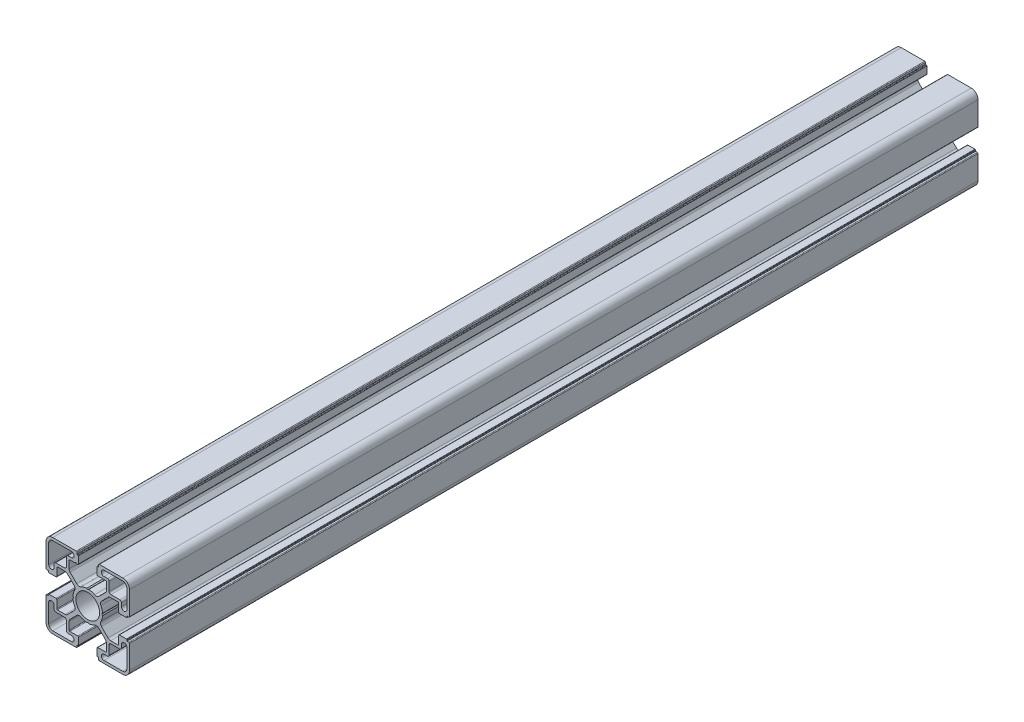
from build123d import *

# Parameters (mm, degrees)
BOSS_EXTRUDE1_DEPTH      = 228.6
FILLET4_R                = 1.885
FILLET5_R                = 0.377
DELETEFACE1_START        = -228.6
DELETEFACE1_DEPTH        = 457.2
CUT_EXTRUDE1_DEPTH       = 231.803942774
CIRPATTERN2_COUNT        = 3
CIRPATTERN2_ANGLE        = 180
FILLET2_R                = 0.377
FILLET3_R                = 0.1885
CUT_EXTRUDE2_DEPTH       = 459.305945848
CUT_EXTRUDE2_DEPTH_BACK  = 459.305945848
SKETCH5_R                = 6.375
BOSS_EXTRUDE2_DEPTH      = 203.2
FILLET6_R                = 0.377
CIRPATTERN1_COUNT        = 8
FILLET6_OF_CIRPATTERN1_R = 0.377
CUT_EXTRUDE3_DEPTH       = 231.803942774
CUT_EXTRUDE3_DEPTH_BACK  = 231.803942774


# Read off the part's stored shape, not the designer's step: DeleteFace1
with BuildPart() as part:
    # Sketch3 → Boss-Extrude1 (new, symmetric)
    with BuildSketch(Plane.XY):
        with BuildLine():
            Line((0, -8), (0, -5))
            ThreePointArc((0, -5), (3.535533906, -3.535533906), (5, 0))
            Line((5, 0), (8, 0))
            ThreePointArc((8, 0), (7.57237156, -2.58054044), (6.335202759, -4.885202759))
            Line((6.335202759, -4.885202759), (11.5, -10.05))
            Line((11.5, -10.05), (16.7, -10.05))
            Line((16.7, -10.05), (16.7, -5))
            Line((16.7, -5), (21.05, -5))
            Line((21.05, -5), (21.05, 0))
            Line((21.05, 0), (22.5, 0))
            Line((22.5, 0), (22.5, -18.875))
            ThreePointArc((22.5, -18.875), (21.438262082, -21.438262082), (18.875, -22.5))
            Line((18.875, -22.5), (0, -22.5))
            Line((0, -22.5), (0, -21.05))
            Line((0, -21.05), (5, -21.05))
            Line((5, -21.05), (5, -16.7))
            Line((5, -16.7), (10.05, -16.7))
            Line((10.05, -16.7), (10.05, -11.5))
            Line((10.05, -11.5), (4.885202759, -6.335202759))
            ThreePointArc((4.885202759, -6.335202759), (2.58054044, -7.57237156), (0, -8))
        make_face()
        with BuildLine():
            Line((18.15, -8.79375), (18.15, -10.5575))
            ThreePointArc((18.15, -10.5575), (17.873948141, -11.223948141), (17.2075, -11.5))
            Line((17.2075, -11.5), (12.4425, -11.5))
            ThreePointArc((12.4425, -11.5), (11.776051859, -11.776051859), (11.5, -12.4425))
            Line((11.5, -12.4425), (11.5, -17.2075))
            ThreePointArc((11.5, -17.2075), (11.223948141, -17.873948141), (10.5575, -18.15))
            Line((10.5575, -18.15), (8.79375, -18.15))
            ThreePointArc((8.79375, -18.15), (7.34375, -19.6), (8.79375, -21.05))
            Line((8.79375, -21.05), (18.875, -21.05))
            ThreePointArc((18.875, -21.05), (20.412957249, -20.412957249), (21.05, -18.875))
            Line((21.05, -18.875), (21.05, -8.79375))
            ThreePointArc((21.05, -8.79375), (19.6, -7.34375), (18.15, -8.79375))
        make_face(mode=Mode.SUBTRACT)
    extrude(amount=BOSS_EXTRUDE1_DEPTH, both=True)

    # Fillet4
    fillet4_edges = [part.edges().sort_by_distance(p)[0] for p in [
        (10.05, -11.5, 0),
        (4.885202759, -6.335202759, 0),
        (6.335202759, -4.885202759, 0),
        (11.5, -10.05, 0),
    ]]
    fillet(fillet4_edges, radius=FILLET4_R)

    # Fillet5
    fillet5_edges = [part.edges().sort_by_distance(p)[0] for p in [
        (5, -21.05, 0),
        (5, -16.7, 0),
        (10.05, -16.7, 0),
        (16.7, -10.05, 0),
        (16.7, -5, 0),
        (21.05, -5, 0),
    ]]
    fillet(fillet5_edges, radius=FILLET5_R)

    # Mirror1: part across plane


with BuildPart() as part_1:
    add(part.part)
    add(part.part.mirror(Plane.ZX))

    # DeleteFace1 outline → DeleteFace1 (cut)
    with BuildSketch(Plane.XY.offset(DELETEFACE1_START)):
        with BuildLine():
            ThreePointArc((4.623, 21.05), (4.889579257, 20.939579257), (5, 20.673))
            Line((5, 20.673), (5, 21.05))
            Line((5, 21.05), (4.623, 21.05))
        make_face()
    extrude(amount=DELETEFACE1_DEPTH, mode=Mode.SUBTRACT)

    # Sketch4 → Cut-Extrude1 (cut, symmetric)
    with BuildSketch(Plane.XY):
        Polygon((5.85, 21.05), (5.85, 22.5), (0, 22.5), (-5.85, 22.5), (-5.85, 21.05), (-5, 21.05), (-5, 16.7), (5, 16.7), (5, 21.05), align=None)
    cut_extrude1 = extrude(amount=CUT_EXTRUDE1_DEPTH, both=True, mode=Mode.SUBTRACT)

    # CirPattern2: Cut-Extrude1 ×3 about axis
    cirpattern2_axis = Axis((0, 0, 269.8), (0, 0, -1))
    for i in range(1, CIRPATTERN2_COUNT):
        add(cut_extrude1.rotate(cirpattern2_axis, i * CIRPATTERN2_ANGLE / (CIRPATTERN2_COUNT - 1)), mode=Mode.SUBTRACT)

    # Fillet2
    fillet2_edges = [part_1.edges().sort_by_distance(p)[0] for p in [
        (5.85, 22.5, 0),
        (22.5, 5.85, 0),
        (22.5, -5.85, 0),
        (5.85, -22.5, 0),
    ]]
    fillet(fillet2_edges, radius=FILLET2_R)

    # Fillet3
    fillet3_edges = [part_1.edges().sort_by_distance(p)[0] for p in [
        (5, 21.05, 0),
        (5.85, 21.05, 0),
        (21.05, -5, 0),
        (21.05, -5.85, 0),
        (21.05, 5, 0),
        (21.05, 5.85, 0),
        (5, -21.05, 0),
        (5.85, -21.05, 0),
    ]]
    fillet(fillet3_edges, radius=FILLET3_R)

    # Mirror2: part across plane


with BuildPart() as part_2:
    add(part_1.part)
    add(part_1.part.mirror(Plane(origin=(0, 0, 0), x_dir=(0, 0, 1), z_dir=(1, 0, 0))))

    # Sketch5 → Cut-Extrude2 (cut, two sides: drawn at the far end of the back side and taken through both)
    with BuildSketch(Plane.XY.offset(228.6).offset(-CUT_EXTRUDE2_DEPTH_BACK)):
        Circle(SKETCH5_R)
        Polygon((-0.580185128, 8), (0.580185128, 8), (0, 7.59375), align=None)
        Polygon((-8, 0.580185128), (-8, -0.580185128), (-7.59375, 0), align=None)
        Polygon((8, 0.580185128), (8, -0.580185128), (7.59375, 0), align=None)
        Polygon((-0.580185128, -8), (0.580185128, -8), (0, -7.59375), align=None)
    extrude(amount=CUT_EXTRUDE2_DEPTH + CUT_EXTRUDE2_DEPTH_BACK, mode=Mode.SUBTRACT)

    # Sketch6 → Boss-Extrude2 (add, symmetric)
    with BuildSketch(Plane.XY):
        with BuildLine():
            Line((-0.97545161, -4.903926402), (-1.243700803, -6.252506163))
            ThreePointArc((-1.243700803, -6.252506163), (0, -6.375), (1.243700803, -6.252506163))
            Line((1.243700803, -6.252506163), (0.97545161, -4.903926402))
            ThreePointArc((0.97545161, -4.903926402), (0, -5), (-0.97545161, -4.903926402))
        make_face()
    boss_extrude2 = extrude(amount=BOSS_EXTRUDE2_DEPTH, both=True)

    # Fillet6
    fillet6_edges = [part_2.edges().sort_by_distance(p)[0] for p in [
        (-1.243700803, -6.252506163, 0),
        (1.243700803, -6.252506163, 0),
    ]]
    fillet(fillet6_edges, radius=FILLET6_R)

    # CirPattern1: Boss-Extrude2 ×8 about axis
    cirpattern1_axis = Axis((0, 0, 0), (0, 0, 1))
    for i in range(1, CIRPATTERN1_COUNT):
        add(boss_extrude2.rotate(cirpattern1_axis, i * 360 / CIRPATTERN1_COUNT))

    # Fillet6 of CirPattern1
    fillet6_of_cirpattern1_edges = [part_2.edges().sort_by_distance(p)[0] for p in [
        (3.541760235, -5.300618778, 0),
        (5.300618778, -3.541760235, 0),
        (6.252506163, -1.243700803, 0),
        (6.252506163, 1.243700803, 0),
        (5.300618778, 3.541760235, 0),
        (3.541760235, 5.300618778, 0),
        (1.243700803, 6.252506163, 0),
        (-1.243700803, 6.252506163, 0),
        (-3.541760235, 5.300618778, 0),
        (-5.300618778, 3.541760235, 0),
        (-6.252506163, 1.243700803, 0),
        (-6.252506163, -1.243700803, 0),
        (-5.300618778, -3.541760235, 0),
        (-3.541760235, -5.300618778, 0),
    ]]
    fillet(fillet6_of_cirpattern1_edges, radius=FILLET6_OF_CIRPATTERN1_R)

    # Sketch7 → Cut-Extrude3 (cut, two sides: drawn at the far end of the back side and taken through both)
    with BuildSketch(Plane.XY.offset(-CUT_EXTRUDE3_DEPTH_BACK)):
        Polygon((-7.031875, 16.7), (-6.596875, 17.135), (-6.161875, 16.7), align=None)
    extrude(amount=CUT_EXTRUDE3_DEPTH + CUT_EXTRUDE3_DEPTH_BACK, mode=Mode.SUBTRACT)


solid = part_2.part
